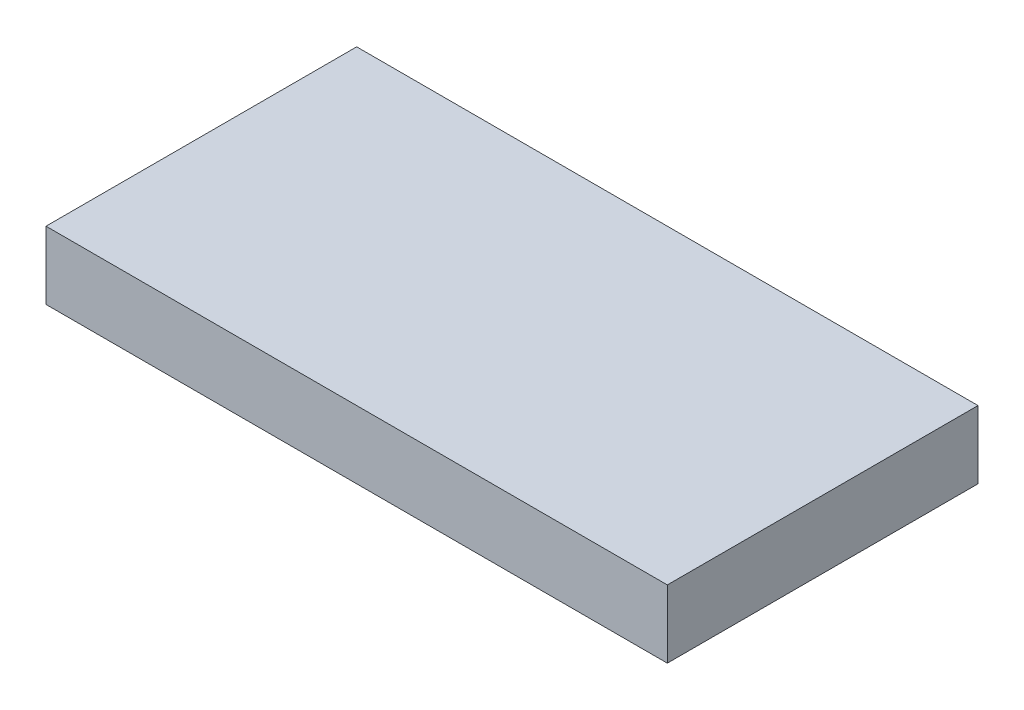
from build123d import *

# Parameters (mm, degrees)
ESQUISSE1_W        = 110
ESQUISSE1_H        = 55
BOSS_EXTRU_1_DEPTH = 12


with BuildPart() as part:
    # Esquisse1 → Boss.-Extru.1 (new body)
    with BuildSketch(Plane(origin=(0, 0, 0), x_dir=(1, 0, 0), z_dir=(0, 1, 0))):
        with Locations((55, 27.5)):
            Rectangle(ESQUISSE1_W, ESQUISSE1_H)
    extrude(amount=BOSS_EXTRU_1_DEPTH)


solid = part.part
